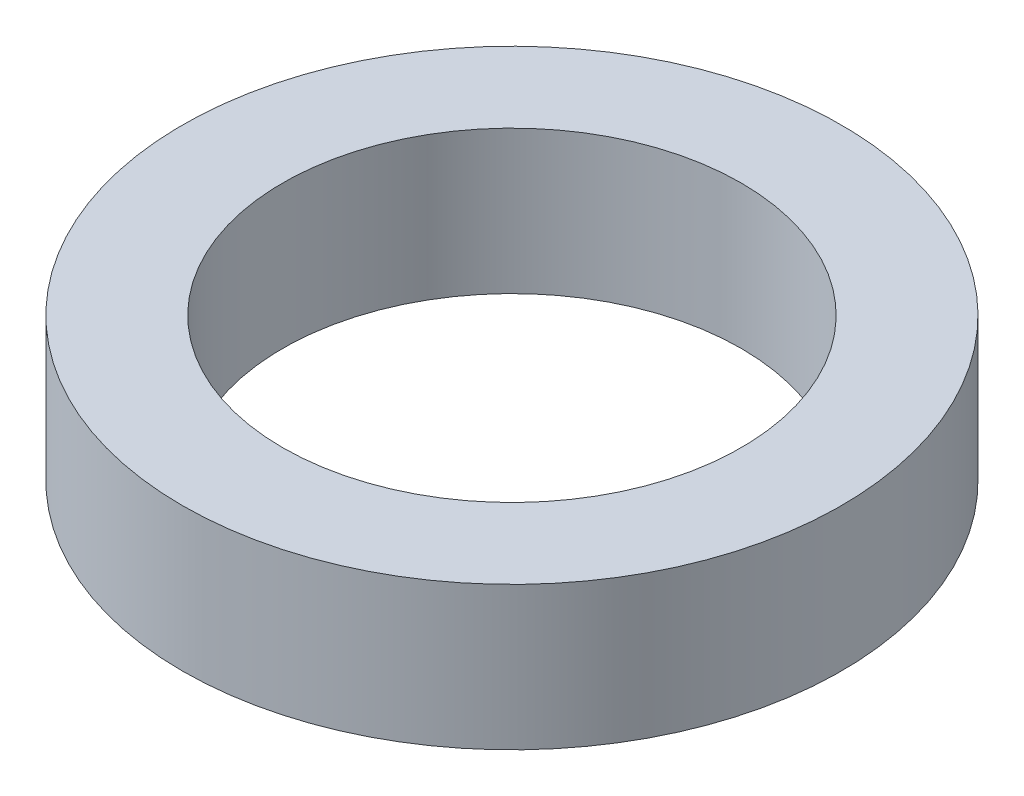
from build123d import *

# Parameters (mm, degrees)
SKETCH1_R           = 57.5
BOSS_EXTRUDE1_DEPTH = 25
SKETCH2_R           = 40
CUT_EXTRUDE1_DEPTH  = 86.073497636


with BuildPart() as part:
    # Sketch1 → Boss-Extrude1 (new body)
    with BuildSketch(Plane(origin=(0, 0, 0), x_dir=(1, 0, 0), z_dir=(0, 1, 0))):
        Circle(SKETCH1_R)
    extrude(amount=BOSS_EXTRUDE1_DEPTH)

    # Sketch2 → Cut-Extrude1 (cut, through all)
    with BuildSketch(Plane(origin=(0, 0, 0), x_dir=(1, 0, 0), z_dir=(0, 1, 0))):
        Circle(SKETCH2_R)
    extrude(amount=CUT_EXTRUDE1_DEPTH, mode=Mode.SUBTRACT)


solid = part.part
